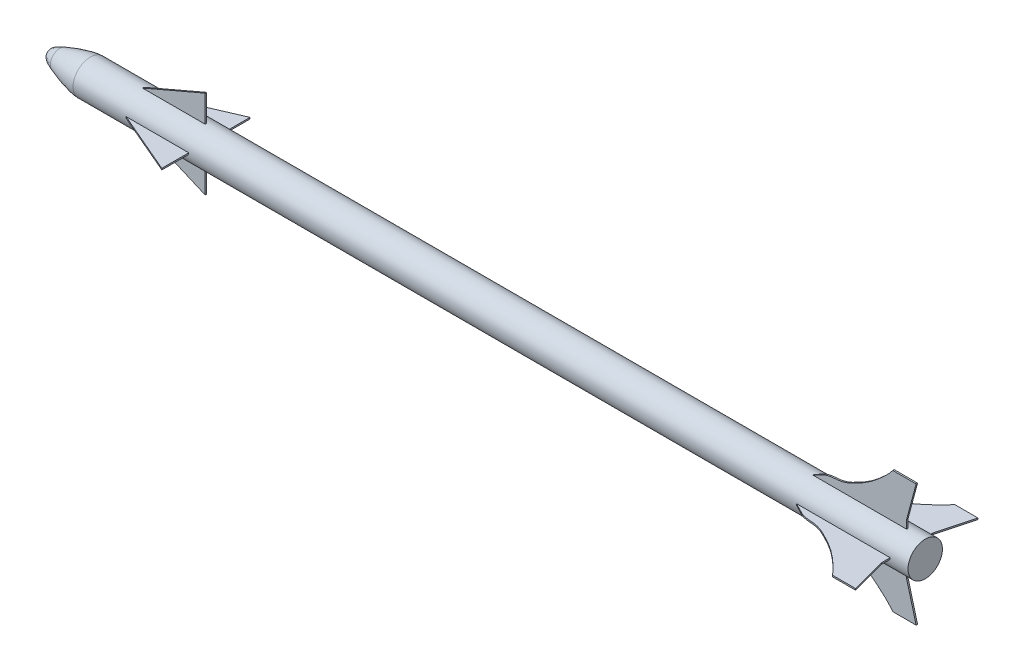
from build123d import *

# Parameters (mm, degrees)
BOSS_EXTRUDE1_DEPTH   = 0.902201371
BOSS_EXTRUDE1_2_DEPTH = 0.902201371
CIRPATTERN1_COUNT     = 4
SCALE1_SCALE          = 2.771


with BuildPart() as part:
    # Sketch1 → Revolve1 (revolve)
    with BuildSketch(Plane.XY, mode=Mode.PRIVATE) as revolve1_sk:
        with BuildLine():
            Line((63.643304359, 93.059708555), (1152.909561315, 93.059708555))
            Line((1152.909561315, 93.059708555), (1152.909561315, 114.445778471))
            Line((1152.909561315, 114.445778471), (115.403746693, 114.445778471))
            add(Edge.make_bspline(
                [(115.403746693, 114.445778471), (102.463666757, 114.445778471), (77.55245191, 104.958295762)],
                knots=[0, 0, 0, 1, 1, 1], degree=2, weights=[1, 0.736255411, 1]))
            add(Edge.make_bspline(
                [(63.643304359, 93.059708555), (65.069439255, 100.204117075), (77.55245191, 104.958295762)],
                knots=[0, 0, 0, 1, 1, 1], degree=2, weights=[1, 1.72125143, 1]))
        make_face()
    revolve(revolve1_sk.sketch.rotate(Axis((63.643304359, 93.059708555, 0), (1, 0, 0)), 90), axis=Axis((63.643304359, 93.059708555, 0), (1, 0, 0)))


with BuildPart() as body_2:
    # Sketch2 → Boss-Extrude1 (new, symmetric)
    with BuildSketch(Plane.XY):
        Polygon((259.079476353, 114.445778471), (259.079476353, 147.852331242), (181.277999104, 114.445778471), (181.277999104, 105.090857442), (259.079476353, 105.090857442), align=None)
    extrude(amount=BOSS_EXTRUDE1_DEPTH, both=True)


with BuildPart() as body_3:
    # Sketch2 → Boss-Extrude1 2 (new, symmetric)
    with BuildSketch(Plane.XY):
        with BuildLine():
            Line((1113.550929378, 169.045735687), (1142.506929378, 169.045735687))
            Line((1142.506929378, 169.045735687), (1130.651812443, 124.862875572))
            Line((1130.651812443, 124.862875572), (1130.651812443, 114.445778471))
            Line((1130.651812443, 114.445778471), (1130.651812443, 107.968193666))
            Line((1130.651812443, 107.968193666), (1014.36417402, 107.968193666))
            Line((1014.36417402, 107.968193666), (1014.36417402, 114.445778471))
            add(Edge.make_bspline(
                [(1014.36417402, 114.445778471), (1020.032573854, 116.832444148), (1026.950065647, 122.053258444), (1038.084104276, 124.268686165), (1046.140189388, 124.440949217), (1056.240129616, 126.835056232), (1068.272190617, 132.565543152), (1082.756221106, 140.522252136), (1098.49699024, 153.111183607), (1108.717711795, 162.820126579), (1113.550929378, 169.045735687)],
                knots=[0, 0, 0, 0, 0.162091832, 0.213838651, 0.291545337, 0.370216786, 0.480165561, 0.635423902, 0.796986484, 1, 1, 1, 1], degree=3))
        make_face()
    extrude(amount=BOSS_EXTRUDE1_2_DEPTH, both=True)


with BuildPart() as cirpattern1_1:
    # CirPattern1: pattern copy
    add(body_3.part.rotate(Axis((63.643304359, 93.059708555, 0), (-1, 0, 0)), 1 * 360 / CIRPATTERN1_COUNT))


with BuildPart() as cirpattern1_2:
    # CirPattern1: pattern copy
    add(body_3.part.rotate(Axis((63.643304359, 93.059708555, 0), (-1, 0, 0)), 2 * 360 / CIRPATTERN1_COUNT))


with BuildPart() as cirpattern1_3:
    # CirPattern1: pattern copy
    add(body_3.part.rotate(Axis((63.643304359, 93.059708555, 0), (-1, 0, 0)), 3 * 360 / CIRPATTERN1_COUNT))


with BuildPart() as cirpattern1_4:
    # CirPattern1: pattern copy
    add(body_2.part.rotate(Axis((63.643304359, 93.059708555, 0), (-1, 0, 0)), 1 * 360 / CIRPATTERN1_COUNT))


with BuildPart() as cirpattern1_5:
    # CirPattern1: pattern copy
    add(body_2.part.rotate(Axis((63.643304359, 93.059708555, 0), (-1, 0, 0)), 2 * 360 / CIRPATTERN1_COUNT))


with BuildPart() as cirpattern1_6:
    # CirPattern1: pattern copy
    add(body_2.part.rotate(Axis((63.643304359, 93.059708555, 0), (-1, 0, 0)), 3 * 360 / CIRPATTERN1_COUNT))


with BuildPart() as body_2_1:
    add(body_2.part)

    # Combine1: union CirPattern1_6, CirPattern1_5, CirPattern1_4, body 3, CirPattern1_1, CirPattern1_3, part, CirPattern1_2
    add(cirpattern1_6.part)
    add(cirpattern1_5.part)
    add(cirpattern1_4.part)
    add(body_3.part)
    add(cirpattern1_1.part)
    add(cirpattern1_3.part)
    add(part.part)
    add(cirpattern1_2.part)


with BuildPart() as body_2_2:
    # Scale1: scaled about (0, 0, 0)
    add(body_2_1.part.scale(SCALE1_SCALE))


with BuildPart() as body_2_3:
    # Body-Move/Copy1: read off the stored shape, not the designer's step
    # Body-Move/Copy1: moved
    add(body_2_2.part.moved(Location((-176.3555964, -257.8684524, 0))))


solid = body_2_3.part
